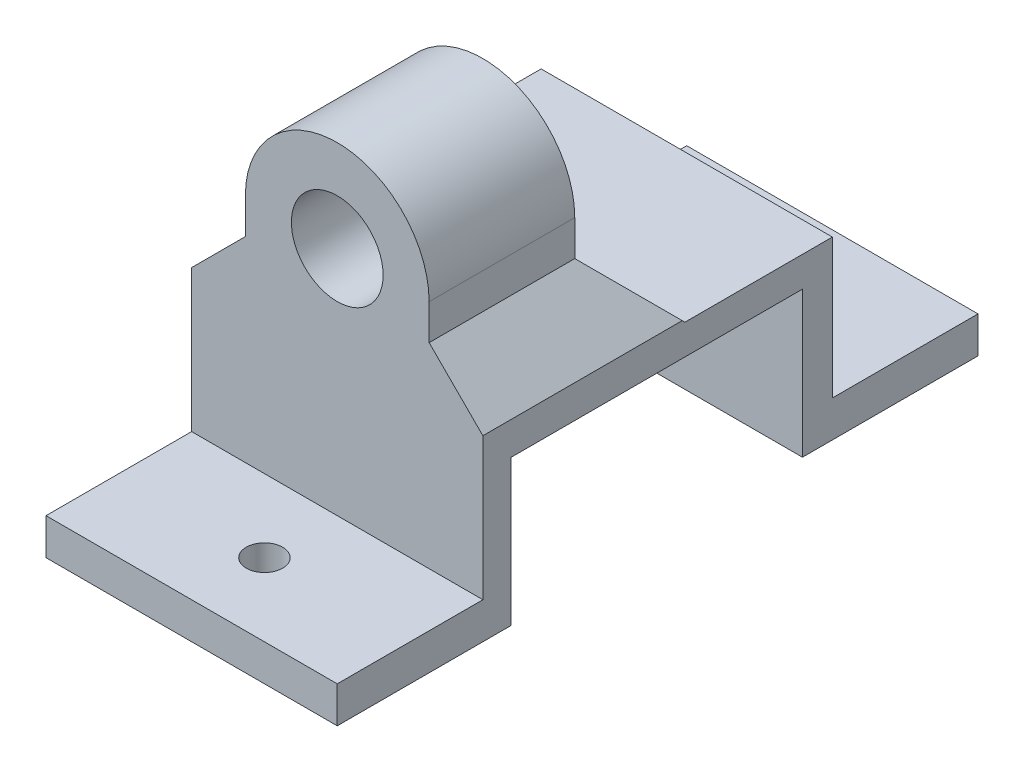
from build123d import *

# Parameters (mm, degrees)
BOSS_EXTRUDE1_DEPTH = 25.4
SKETCH2_R           = 4
BOSS_EXTRUDE2_DEPTH = 12.7
CHAMFER1_SIZE       = 4.92
CHAMFER2_SIZE       = 4.92
SKETCH3_R           = 1.5875
CUT_EXTRUDE1_DEPTH  = 12.7


with BuildPart() as part:
    # Sketch1 → Boss-Extrude1 (new body)
    with BuildSketch(Plane(origin=(0, 0, 0), x_dir=(0, 0, -1), z_dir=(1, 0, 0))):
        Polygon((12.7, 12.800996681), (-12.7, 12.800996681), (-12.7, 0.100996681), (-27.872338694, 0.100996681), (-27.872338694, 3.275996681), (-15.172338694, 3.275996681), (-15.172338694, 15.4293954), (15.307661306, 15.4293954), (15.307661306, 3.275996681), (28.007661306, 3.275996681), (28.007661306, 0.100996681), (12.7, 0.100996681), align=None)
    extrude(amount=BOSS_EXTRUDE1_DEPTH)

    # Sketch2 → Boss-Extrude2 (add)
    with BuildSketch(Plane.XY.offset(15.172338694)):
        with BuildLine():
            Line((4.687120924, 23.442274476), (4.687120924, 15.4293954))
            Line((4.687120924, 15.4293954), (20.712879076, 15.4293954))
            Line((20.712879076, 15.4293954), (20.712879076, 23.442274476))
            ThreePointArc((20.712879076, 23.442274476), (12.7, 31.455153552), (4.687120924, 23.442274476))
        make_face()
        with Locations((12.7, 23.442274476)):
            Circle(SKETCH2_R, mode=Mode.SUBTRACT)
    extrude(amount=-BOSS_EXTRUDE2_DEPTH)

    # Chamfer1
    # the kernel refuses this chamfer: 4.92 mm, written as the material it adds along each edge
    with BuildSketch(Plane(origin=(4.687120924, 15.4293954, 15.172338694), x_dir=(-0.9996219169112966, -0.027495876610586726, 0), z_dir=(0, 0, -1))) as chamfer1_piece_1_section:
        Polygon((CHAMFER1_SIZE * 0.999621916911, CHAMFER1_SIZE * 0.0274958766106), (-CHAMFER1_SIZE * 0.0274958766106, CHAMFER1_SIZE * 0.999621916911), (0, 0), align=None)
    chamfer1_piece_1 = extrude(amount=12.7, mode=Mode.PRIVATE)
    chamfer1_piece_1 = split(chamfer1_piece_1, bisect_by=Plane(origin=(0, 17.064795435, 8.822338694), z_dir=(1, 0, 0)), keep=Keep.TOP, mode=Mode.PRIVATE)
    add(chamfer1_piece_1)
    with BuildSketch(Plane(origin=(20.712879076, 15.4293954, 15.172338694), x_dir=(0.9996219169112966, -0.02749587661058674, 0), z_dir=(0, 0, -1))) as chamfer1_piece_2_section:
        Polygon((CHAMFER1_SIZE * 0.999621916911, -CHAMFER1_SIZE * 0.0274958766106), (-CHAMFER1_SIZE * 0.0274958766106, -CHAMFER1_SIZE * 0.999621916911), (0, 0), align=None)
    chamfer1_piece_2 = extrude(amount=12.7, mode=Mode.PRIVATE)
    chamfer1_piece_2 = split(chamfer1_piece_2, bisect_by=Plane(origin=(25.4, 17.064795435, 8.822338694), z_dir=(-1, 0, 0)), keep=Keep.TOP, mode=Mode.PRIVATE)
    add(chamfer1_piece_2)

    # Chamfer2
    # the kernel refuses this chamfer: 4.92 mm, written as the material it adds along each edge
    with BuildSketch(Plane(origin=(25.4, 15.4293954, 2.472338694), x_dir=(0, -0.02749587661026744, -0.9996219169113054), z_dir=(-1, 0, 0))) as chamfer2_piece_1_section:
        Polygon((CHAMFER2_SIZE * 0.999621916911, -CHAMFER2_SIZE * 0.0274958766106), (-CHAMFER2_SIZE * 0.0274958766103, -CHAMFER2_SIZE * 0.999621916911), (0, 0), align=None)
    chamfer2_piece_1 = extrude(amount=25.4, mode=Mode.PRIVATE)
    chamfer2_piece_1 = split(chamfer2_piece_1, bisect_by=Plane(origin=(23.520525821, 17.541748655, 0.607229555), z_dir=(-0.7071067811868302, -0.7071067811862649, 0)), keep=Keep.TOP, mode=Mode.PRIVATE)
    chamfer2_piece_1 = split(chamfer2_piece_1, bisect_by=Plane(origin=(20.712879076, 16.594460185, 0.607229555), z_dir=(1, 0, 0)), keep=Keep.TOP, mode=Mode.PRIVATE)
    add(chamfer2_piece_1)
    with BuildSketch(Plane(origin=(25.4, 15.4293954, 2.472338694), x_dir=(0, -0.02749587661026744, -0.9996219169113054), z_dir=(-1, 0, 0))) as chamfer2_piece_2_section:
        Polygon((CHAMFER2_SIZE * 0.999621916911, -CHAMFER2_SIZE * 0.0274958766106), (-CHAMFER2_SIZE * 0.0274958766103, -CHAMFER2_SIZE * 0.999621916911), (0, 0), align=None)
    chamfer2_piece_2 = extrude(amount=25.4, mode=Mode.PRIVATE)
    chamfer2_piece_2 = split(chamfer2_piece_2, bisect_by=Plane(origin=(7.03196097, 22.694235446, 0.836220955), z_dir=(0.7071067811868302, -0.7071067811862649, 0)), keep=Keep.TOP, mode=Mode.PRIVATE)
    chamfer2_piece_2 = split(chamfer2_piece_2, bisect_by=Plane(origin=(4.687120924, 17.026196416, 0.836220955), z_dir=(1, 0, 0)), keep=Keep.TOP, mode=Mode.PRIVATE)
    chamfer2_piece_2 = split(chamfer2_piece_2, bisect_by=Plane(origin=(20.712879076, 17.026196416, 0.836220955), z_dir=(-1, 0, 0)), keep=Keep.TOP, mode=Mode.PRIVATE)
    chamfer2_piece_2 = chamfer2_piece_2 - Plane(origin=(12.7, 23.442274476, 0.836220955), x_dir=(1, 0, 0), z_dir=(0, 0, 1)) * Cylinder(4, 71, mode=Mode.PRIVATE)
    add(chamfer2_piece_2)
    with BuildSketch(Plane(origin=(25.4, 15.4293954, 2.472338694), x_dir=(0, -0.02749587661026744, -0.9996219169113054), z_dir=(-1, 0, 0))) as chamfer2_piece_3_section:
        Polygon((CHAMFER2_SIZE * 0.999621916911, -CHAMFER2_SIZE * 0.0274958766106), (-CHAMFER2_SIZE * 0.0274958766103, -CHAMFER2_SIZE * 0.999621916911), (0, 0), align=None)
    chamfer2_piece_3 = extrude(amount=25.4, mode=Mode.PRIVATE)
    chamfer2_piece_3 = split(chamfer2_piece_3, bisect_by=Plane(origin=(1.879474179, 17.541748655, 0.607229555), z_dir=(0.7071067811868302, -0.7071067811862649, 0)), keep=Keep.TOP, mode=Mode.PRIVATE)
    chamfer2_piece_3 = split(chamfer2_piece_3, bisect_by=Plane(origin=(4.687120924, 16.594460185, 0.607229555), z_dir=(-1, 0, 0)), keep=Keep.TOP, mode=Mode.PRIVATE)
    add(chamfer2_piece_3)

    # Sketch3 → Cut-Extrude1 (cut)
    with BuildSketch(Plane(origin=(0, 3.275996681, 0), x_dir=(1, 0, 0), z_dir=(0, 1, 0))):
        with Locations(Location((12.7, 21.657661306, 0), (0, 0, 270))):
            Circle(SKETCH3_R)
        with Locations(Location((12.7, -21.522338694, 0), (0, 0, 270))):
            Circle(SKETCH3_R)
    extrude(amount=-CUT_EXTRUDE1_DEPTH, mode=Mode.SUBTRACT)


solid = part.part
